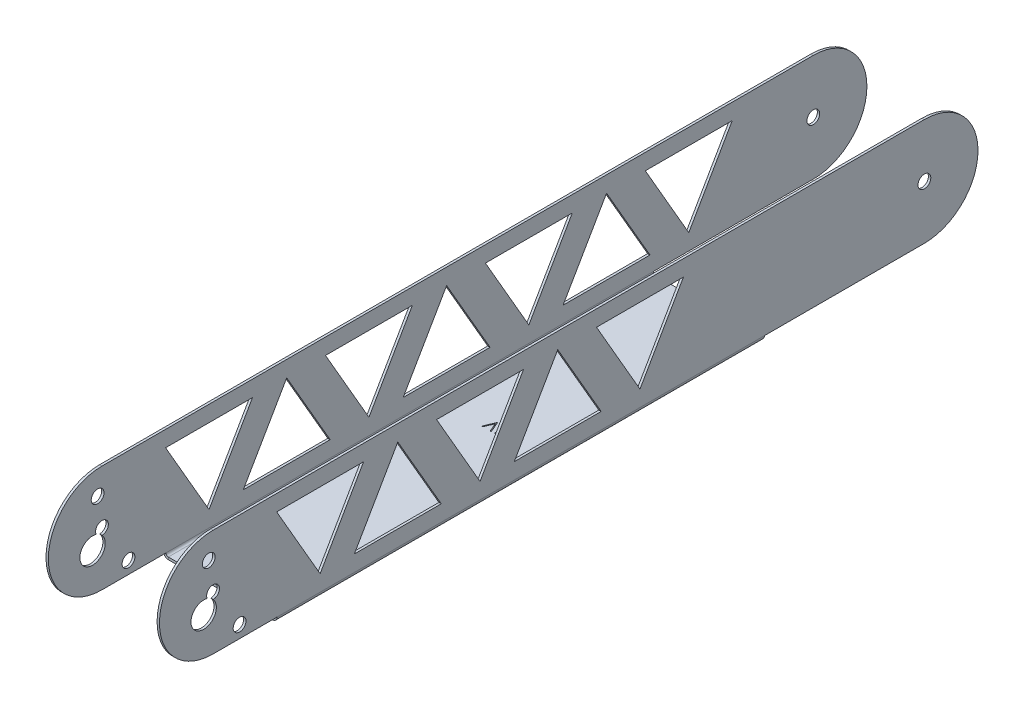
from build123d import *

# Parameters (mm, degrees)
SKETCH1_W                         = 32
SKETCH1_H                         = 152.4
BASE_FLANGE1_DEPTH                = 0.7366
EDGE_FLANGE1_DEPTH                = 152.4
EDGE_FLANGE1_BEND_DEPTH           = 152.4
SKETCH13_R                        = 2
TAB1_DEPTH                        = 0.7366
SKETCH21_R                        = 2
TAB2_DEPTH                        = 0.7366
CUT_EXTRUDE5_DEPTH                = 378.459903207
CUT_EXTRUDE5_DEPTH_BACK           = 378.459903207
SKETCH27_R                        = 3.96875
CUT_EXTRUDE6_DEPTH                = 152.231154983
CUT_EXTRUDE9_DEPTH                = 5
CUT_EXTRUDE10_DEPTH               = 5
SKETCH42_W                        = 2
SKETCH42_H                        = 35.4732
F_4_0_4_DIAMETER_HOLE1_AT_2_COUNT = 2
F_4_0_4_DIAMETER_HOLE1_AT_2_PITCH = 24.194584718


# Sheet-metal steps are written as plain solids
with BuildPart() as part:
    # Sketch1 → Base-Flange1 (new body)
    with BuildSketch(Plane(origin=(0, 0, 0), x_dir=(1, 0, 0), z_dir=(0, 1, 0))):
        Rectangle(SKETCH1_W, SKETCH1_H)
    extrude(amount=-BASE_FLANGE1_DEPTH)

    # Edge-Flange1 section (across the edge) → Edge-Flange1 (add)
    with BuildSketch(Plane(origin=(17, 0, 76.2), x_dir=(-1, 0, 0), z_dir=(0, 0, -1))):
        with BuildLine():
            Line((-0.7366, 0.7366), (-0.7366, 34.2634))
            Line((-0.7366, 34.2634), (0, 34.2634))
            Line((0, 34.2634), (0, 0.7366))
            ThreePointArc((0, 0.7366), (0.215745145, 0.215745145), (0.7366, 0))
            Line((0.7366, 0), (1, 0))
            Line((1, 0), (1, -0.7366))
            Line((1, -0.7366), (0.7366, -0.7366))
            ThreePointArc((0.7366, -0.7366), (-0.30510971, -0.30510971), (-0.7366, 0.7366))
        make_face()
    extrude(amount=EDGE_FLANGE1_DEPTH)

    # Edge-Flange1 section 2 (across the edge) → Edge-Flange1 bend (add)
    with BuildSketch(Plane(origin=(-17, 0, -76.2), x_dir=(1, 0, 0), z_dir=(0, 0, 1))):
        with BuildLine():
            Line((-0.7366, 0.7366), (-0.7366, 34.2634))
            Line((-0.7366, 34.2634), (0, 34.2634))
            Line((0, 34.2634), (0, 0.7366))
            ThreePointArc((0, 0.7366), (0.215745145, 0.215745145), (0.7366, 0))
            Line((0.7366, 0), (1, 0))
            Line((1, 0), (1, -0.7366))
            Line((1, -0.7366), (0.7366, -0.7366))
            ThreePointArc((0.7366, -0.7366), (-0.30510971, -0.30510971), (-0.7366, 0.7366))
        make_face()
    extrude(amount=EDGE_FLANGE1_BEND_DEPTH)

    # Sketch13 → Tab1 (add)
    with BuildSketch(Plane(origin=(17.7366, 0, 0), x_dir=(0, 0, -1), z_dir=(1, 0, 0))):
        with BuildLine():
            Line((76.2, 0.7366), (76.2, 34.2634))
            Line((76.2, 34.2634), (126.2, 34.2634))
            ThreePointArc((126.2, 34.2634), (142.9634, 17.5), (126.2, 0.7366))
            Line((126.2, 0.7366), (76.2, 0.7366))
        make_face()
        with Locations(Location((126.2, 17.5, 0), (0, 0, 90))):
            Circle(SKETCH13_R, mode=Mode.SUBTRACT)
    tab1 = extrude(amount=-TAB1_DEPTH)

    # Mirror1: Tab1 across plane
    add(tab1.mirror(Plane(origin=(0, 0, 0), x_dir=(0, 0, 1), z_dir=(1, 0, 0))))

    # Sketch21 → Tab2 (add)
    with BuildSketch(Plane.ZY.offset(17.7366)):
        with BuildLine():
            Line((76.2, 0.7366), (76.2, 34.2634))
            Line((76.2, 34.2634), (96.2, 34.2634))
            ThreePointArc((96.2, 34.2634), (112.9634, 17.5), (96.2, 0.7366))
            Line((96.2, 0.7366), (76.2, 0.7366))
        make_face()
        with Locations(Location((96.2, 17.5, 0), (0, 0, 270))):
            Circle(SKETCH21_R, mode=Mode.SUBTRACT)
    tab2 = extrude(amount=-TAB2_DEPTH)

    # Mirror2: Tab2 across plane
    add(tab2.mirror(Plane(origin=(0, 0, 0), x_dir=(0, 0, 1), z_dir=(1, 0, 0))))

    # Sketch27 → Cut-Extrude5 (cut, two sides: drawn at the far end of the back side and taken through both)
    with BuildSketch(Plane(origin=(-1.8, 181.68919546, 186.907982421), x_dir=(6.7392179279257654e-15, -0.7462813550386803, 0.6656306326496935), z_dir=(1, 0, 0)).offset(-CUT_EXTRUDE5_DEPTH_BACK)):
        with Locations((67.576820433, 177.878571709)):
            Circle(SKETCH27_R)
    extrude(amount=CUT_EXTRUDE5_DEPTH + CUT_EXTRUDE5_DEPTH_BACK, mode=Mode.SUBTRACT)

    # Sketch28 → Cut-Extrude6 (cut, through all)
    with BuildSketch(Plane.ZY.offset(17.7366)):
        Polygon((76.313906493, 29.2634), (49.147497867, 29.2634), (62.73070218, 5.7366), align=None)
        Polygon((52.02060197, 5.7366), (38.437397657, 29.2634), (24.854193344, 5.7366), align=None)
        Polygon((26.313906493, 29.2634), (-0.852502133, 29.2634), (12.73070218, 5.7366), align=None)
        Polygon((2.02060197, 5.7366), (-11.562602343, 29.2634), (-25.145806656, 5.7366), align=None)
        Polygon((-23.686093507, 29.2634), (-50.852502133, 29.2634), (-37.26929782, 5.7366), align=None)
    extrude(amount=-CUT_EXTRUDE6_DEPTH, mode=Mode.SUBTRACT)

    # Sketch34 → Cut-Extrude9 (cut)
    with BuildSketch(Plane.ZY.offset(17.7366)):
        Polygon((-47.97939803, 5.7366), (-75.145806656, 5.7366), (-61.562602343, 29.2634), align=None)
        Polygon((-73.686093507, 29.2634), (-100.852502133, 29.2634), (-87.26929782, 5.7366), align=None)
    extrude(amount=-CUT_EXTRUDE9_DEPTH, mode=Mode.SUBTRACT)

    # Sketch36 → Cut-Extrude10 (cut)
    # profile 1 of 4: a face of its own
    with BuildSketch(Plane.XZ.offset(0.7366)):
        Polygon((-2.7193999, -8.2157924), (-2.382861438, -8.2157924), (-1.216194772, -10.974005541), (-0.049528105, -8.2157924), (0.287010356, -8.2157924), (-1.193758874, -11.7157924), (-1.238630669, -11.7157924), align=None)
    # profile 2 of 4: a face of its own
    with BuildSketch(Plane.XZ.offset(0.7366)):
        Polygon((1.345003145, -8.2157924), (1.992138562, -8.2157924), (1.992138562, -11.7157924), (1.678035997, -11.7157924), (1.678035997, -8.574766759), (1.139574459, -8.574766759), align=None)
    # profile 3 of 4: a face of its own
    with BuildSketch(Plane.XZ.offset(0.7366)):
        with BuildLine():
            add(Edge.make_bspline(
                [(3.854318049, -11.177330861), (3.873808261, -11.178489028), (3.912016543, -11.180759478), (3.967255672, -11.196336152), (4.017250331, -11.223994813), (4.061782576, -11.260857591), (4.098489053, -11.305553254), (4.127133405, -11.355149163), (4.14257439, -11.410850755), (4.144828302, -11.44928043), (4.145984715, -11.468997528)],
                knots=[0, 0, 0, 0, 1.020151414, 1.999887582, 2.974338812, 3.990962822, 5.007586832, 5.987933904, 6.967670073, 8, 8, 8, 8], degree=3))
            add(Edge.make_bspline(
                [(4.145984715, -11.468997528), (4.144789115, -11.488240858), (4.142431408, -11.526188421), (4.127168799, -11.581469884), (4.098270749, -11.631096789), (4.062035756, -11.676398927), (4.017239323, -11.713339797), (3.967137476, -11.740763142), (3.912146218, -11.757455122), (3.873829895, -11.759581419), (3.854318049, -11.760664195)],
                knots=[0, 0, 0, 0, 1.009421747, 1.99056486, 2.972319754, 3.999869655, 5.017953583, 5.993804169, 6.978383603, 8, 8, 8, 8], degree=3))
            add(Edge.make_bspline(
                [(3.854318049, -11.760664195), (3.834792143, -11.759620597), (3.79667246, -11.757583222), (3.741886466, -11.740420416), (3.691479498, -11.713596956), (3.646691786, -11.676330046), (3.610153314, -11.631329903), (3.582527931, -11.581128107), (3.565937782, -11.526346669), (3.56375591, -11.488272026), (3.562651382, -11.468997528)],
                knots=[0, 0, 0, 0, 1.022052826, 1.995314843, 2.982371812, 4.00089066, 5.028879526, 6.005146991, 6.990147033, 8, 8, 8, 8], degree=3))
            add(Edge.make_bspline(
                [(3.562651382, -11.468997528), (3.563713481, -11.449248148), (3.5657871, -11.410689908), (3.58256276, -11.355490801), (3.609938972, -11.305322362), (3.646944367, -11.260925781), (3.691468663, -11.223738479), (3.741764868, -11.196673686), (3.796804408, -11.180633273), (3.834814347, -11.178450757), (3.854318049, -11.177330861)],
                knots=[0, 0, 0, 0, 1.032775665, 2.016367738, 2.991239715, 4.008302682, 5.025365648, 6.011011707, 6.979408107, 8, 8, 8, 8], degree=3))
        make_face()
    # profile 4 of 4: a face of its own
    with BuildSketch(Plane.XZ.offset(0.7366)):
        with BuildLine():
            add(Edge.make_bspline(
                [(4.594702664, -9.967194643), (4.595030682, -9.911097256), (4.595667862, -9.802127271), (4.602756283, -9.643342629), (4.614531625, -9.49438234), (4.630668998, -9.355239274), (4.650306979, -9.22587751), (4.676522465, -9.106642753), (4.706335268, -8.996983146), (4.740887714, -8.896541098), (4.779875503, -8.803963395), (4.822309763, -8.717538193), (4.869874558, -8.637396261), (4.919851471, -8.56225847), (4.974263542, -8.493354776), (5.031562333, -8.429712113), (5.093984209, -8.372801363), (5.159407217, -8.32095506), (5.228423682, -8.275505589), (5.299066348, -8.23547285), (5.371821454, -8.201272983), (5.446887637, -8.174382547), (5.523590194, -8.1521717), (5.602197261, -8.136982752), (5.682838625, -8.127425844), (5.73727006, -8.126512176), (5.76487494, -8.12604881)],
                knots=[0, 0, 0, 0, 1.646270934, 3.197905019, 4.663502075, 6.030701355, 7.308322542, 8.50163776, 9.611534131, 10.641858119, 11.616356847, 12.558055219, 13.465016945, 14.349605745, 15.204443733, 16.039544428, 16.859896111, 17.680448484, 18.487036065, 19.28249412, 20.06191084, 20.843045899, 21.620316918, 22.403196591, 23.190181807, 24, 24, 24, 24], degree=3))
            add(Edge.make_bspline(
                [(5.76487494, -8.12604881), (5.792710418, -8.126536625), (5.848066427, -8.127506736), (5.929906802, -8.136830679), (6.009856484, -8.152301802), (6.087574623, -8.174222776), (6.163699609, -8.201418453), (6.237636017, -8.23550557), (6.309843099, -8.275184437), (6.379173386, -8.321808315), (6.446388001, -8.373790591), (6.509835964, -8.43255326), (6.56952305, -8.497502979), (6.626198356, -8.567944843), (6.678253953, -8.645229928), (6.727827385, -8.728014038), (6.772199421, -8.817744902), (6.814934096, -8.91292537), (6.851821083, -9.016189029), (6.885087328, -9.12695379), (6.911966297, -9.246527976), (6.934355569, -9.374284222), (6.951700465, -9.510691705), (6.964333107, -9.65545802), (6.971006192, -9.808678411), (6.972262893, -9.91343626), (6.972907792, -9.967194643)],
                knots=[0, 0, 0, 0, 0.810914788, 1.612654377, 2.396697861, 3.181598691, 3.963628158, 4.749916497, 5.551656086, 6.361998678, 7.18212741, 8.025565596, 8.878627764, 9.750805457, 10.657531673, 11.591944965, 12.560506719, 13.57287815, 14.630710178, 15.753379473, 16.941251878, 18.199788006, 19.531962791, 20.947069417, 22.433333509, 24, 24, 24, 24], degree=3))
            add(Edge.make_bspline(
                [(6.972907792, -9.967194643), (6.972256208, -10.020718551), (6.970986622, -10.125007703), (6.964407915, -10.277538678), (6.951449284, -10.421536722), (6.935239296, -10.557347184), (6.912788333, -10.684404803), (6.885183166, -10.803149252), (6.854532844, -10.914093323), (6.816698049, -11.016328135), (6.775287339, -11.111279858), (6.730232143, -11.199947006), (6.681962317, -11.283113299), (6.629373572, -11.360113046), (6.573320159, -11.431491703), (6.51260237, -11.495989325), (6.448931785, -11.555159997), (6.381519369, -11.607811625), (6.311107818, -11.653896429), (6.239148741, -11.69511028), (6.164365357, -11.728342975), (6.088452405, -11.756878016), (6.010324039, -11.778678468), (5.930077648, -11.793752323), (5.848121412, -11.804324172), (5.792719847, -11.805130652), (5.76487494, -11.80553599)],
                knots=[0, 0, 0, 0, 1.561518951, 3.042555995, 4.452378317, 5.7783523, 7.031515105, 8.214008947, 9.334062868, 10.386615937, 11.391082383, 12.354592575, 13.286541444, 14.194233754, 15.072674879, 15.931287219, 16.775624067, 17.606195743, 18.42308326, 19.229000347, 20.022332153, 20.807536673, 21.593273796, 22.3848459, 23.188221202, 24, 24, 24, 24], degree=3))
            add(Edge.make_bspline(
                [(5.76487494, -11.80553599), (5.737270826, -11.805069634), (5.682840901, -11.804150072), (5.602188476, -11.794636341), (5.523906032, -11.779340837), (5.447607278, -11.757924233), (5.372900763, -11.731709397), (5.300804476, -11.697555713), (5.230516793, -11.658221644), (5.162225237, -11.613426223), (5.097213076, -11.56210454), (5.03511447, -11.505340251), (4.977489451, -11.44171684), (4.923855356, -11.372238917), (4.872881267, -11.297545674), (4.825991894, -11.216617301), (4.78262104, -11.129774691), (4.742977549, -11.03645678), (4.707828886, -10.935301852), (4.676781178, -10.825152674), (4.65226702, -10.705037038), (4.631284065, -10.575919671), (4.614359682, -10.43724574), (4.602805356, -10.288939962), (4.595664041, -10.131094753), (4.595028971, -10.022824979), (4.594702664, -9.967194643)],
                knots=[0, 0, 0, 0, 0.810891512, 1.598919785, 2.382837074, 3.152667961, 3.926044502, 4.706494248, 5.493654104, 6.291793342, 7.103789334, 7.925228297, 8.761435821, 9.622817696, 10.50288917, 11.416980706, 12.369136599, 13.353924996, 14.394355917, 15.514179734, 16.714354668, 17.994756427, 19.357759367, 20.818452758, 22.365282078, 24, 24, 24, 24], degree=3))
        make_face()
        with BuildLine():
            add(Edge.make_bspline(
                [(4.908805228, -9.9657924), (4.908924675, -10.012541099), (4.909156499, -10.103271143), (4.915212699, -10.235114404), (4.923462931, -10.358084733), (4.934104228, -10.47233827), (4.949907177, -10.577488282), (4.967613965, -10.674257965), (4.989162054, -10.762135202), (5.014657072, -10.841723013), (5.043696169, -10.914372082), (5.075402033, -10.981973297), (5.109462756, -11.045325233), (5.147581906, -11.103858841), (5.189096969, -11.157765006), (5.233070229, -11.207997838), (5.281142813, -11.252794819), (5.347646555, -11.306521674), (5.43544303, -11.362040808), (5.546063485, -11.410386898), (5.659731936, -11.440769354), (5.736883186, -11.44463311), (5.775391767, -11.446561631)],
                knots=[0, 0, 0, 0, 1.459021318, 2.831673884, 4.118529203, 5.306027144, 6.411944654, 7.436330062, 8.375795394, 9.233974572, 10.042671642, 10.816086306, 11.563610507, 12.285937304, 12.993564865, 13.685989202, 14.367179055, 15.041617293, 16.353048772, 17.594441528, 18.799311195, 20, 20, 20, 20], degree=3))
            add(Edge.make_bspline(
                [(5.775391767, -11.446561631), (5.814149438, -11.44496385), (5.891584761, -11.441771587), (6.004718557, -11.41097285), (6.114548827, -11.36450331), (6.200620767, -11.309555805), (6.26610331, -11.257227475), (6.313020301, -11.212612827), (6.356082349, -11.16265696), (6.396924424, -11.108757664), (6.4343835, -11.04988518), (6.468446637, -10.986322604), (6.499529985, -10.917893426), (6.517239031, -10.870123687), (6.526293209, -10.845700252)],
                knots=[0, 0, 0, 0, 1.353760809, 2.704726607, 4.075137775, 5.516104923, 6.260822281, 7.007110065, 7.778089737, 8.566572457, 9.372053459, 10.217411131, 11.088608312, 12, 12, 12, 12], degree=3))
            add(Edge.make_bspline(
                [(6.526293209, -10.845700252), (6.536844977, -10.814470513), (6.558269591, -10.751060749), (6.585881365, -10.652697097), (6.607626764, -10.549494333), (6.62719013, -10.442069216), (6.640543186, -10.329629515), (6.651290999, -10.212523131), (6.657621686, -10.090661769), (6.658406437, -10.007866778), (6.658805228, -9.9657924)],
                knots=[0, 0, 0, 0, 0.884706709, 1.796334032, 2.740027952, 3.714592787, 4.726048262, 5.777819803, 6.87074269, 8, 8, 8, 8], degree=3))
            add(Edge.make_bspline(
                [(6.658805228, -9.9657924), (6.658255039, -9.923724827), (6.657178751, -9.841431662), (6.653064763, -9.720913482), (6.642441189, -9.606445721), (6.63064207, -9.497535248), (6.613244849, -9.394784946), (6.594487042, -9.29733464), (6.56928583, -9.206391615), (6.542366055, -9.120532034), (6.511555659, -9.040731379), (6.477639925, -8.966617593), (6.441418166, -8.897832868), (6.402075926, -8.834565927), (6.360080243, -8.776533384), (6.314322694, -8.724898789), (6.266618321, -8.678061821), (6.199801135, -8.624599252), (6.112326845, -8.570087556), (6.003481198, -8.519921797), (5.890210554, -8.491113504), (5.813637099, -8.487051817), (5.775391767, -8.485023169)],
                knots=[0, 0, 0, 0, 1.31362396, 2.569729283, 3.763502607, 4.902122613, 5.988968491, 7.01645872, 7.998833611, 8.933434873, 9.825090667, 10.667526885, 11.477055099, 12.250526234, 12.991942729, 13.710640831, 14.402115721, 15.076753259, 16.378508321, 17.609869233, 18.806226677, 20, 20, 20, 20], degree=3))
            add(Edge.make_bspline(
                [(5.775391767, -8.485023169), (5.736681175, -8.487054616), (5.659189469, -8.49112121), (5.544741514, -8.519814463), (5.435037163, -8.569827429), (5.347794188, -8.624779802), (5.280930401, -8.677118113), (5.233847708, -8.722504567), (5.189701536, -8.772150822), (5.149033836, -8.826552736), (5.110944552, -8.885018104), (5.07596354, -8.948006869), (5.04444621, -9.015838233), (5.015361674, -9.088454668), (4.989788886, -9.168035613), (4.968694923, -9.255804606), (4.94920787, -9.352266498), (4.935412601, -9.457986006), (4.923148845, -9.572268159), (4.915267497, -9.695545478), (4.90913624, -9.827609858), (4.908917775, -9.918809016), (4.908805228, -9.9657924)],
                knots=[0, 0, 0, 0, 1.207732386, 2.417664972, 3.655092373, 4.956220595, 5.625982001, 6.301752483, 6.994047911, 7.697131622, 8.419323945, 9.170223765, 9.943494443, 10.752040957, 11.610060368, 12.549350801, 13.567764191, 14.679664412, 15.874934091, 17.154273443, 18.533957287, 20, 20, 20, 20], degree=3))
        make_face(mode=Mode.SUBTRACT)
    extrude(amount=-CUT_EXTRUDE10_DEPTH, mode=Mode.SUBTRACT)


with BuildPart() as cut_extrude10_piece_1:
    # of the separate pieces the step leaves, piece 1, a body of its own (cut_extrude10_pieces)
    add(part.part.solids().sort_by_distance((16.2634, -0.7366, -76.2))[0])

    # Sketch42 → Ø4.0 (4) Diameter Hole1 (revolve, cut)
    with BuildSketch(Plane(origin=(-17.7366, 4.550436979, 87.910687259), x_dir=(0, 0, 1), z_dir=(0, 1, 0))):
        with Locations((1, 17.7366)):
            Rectangle(SKETCH42_W, SKETCH42_H)
    f_4_0_4_diameter_hole1 = revolve(axis=Axis((-24.0866, 4.550436979, 87.910687259), (1, 0, 0)), mode=Mode.SUBTRACT)

    # Ø4.0 (4) Diameter Hole1 at 2: Ø4.0 (4) Diameter Hole1 ×2
    with Locations(*[Vector(-3.1203331884280615e-15, 0.9169563730061802, 0.39898748101080944) * (i * F_4_0_4_DIAMETER_HOLE1_AT_2_PITCH) for i in range(1, F_4_0_4_DIAMETER_HOLE1_AT_2_COUNT)]):
        add(f_4_0_4_diameter_hole1, mode=Mode.SUBTRACT)


with BuildPart() as cut_extrude10_piece_2:
    # of the separate pieces the step leaves, piece 2, a body of its own (cut_extrude10_pieces)
    add(part.part.solids().sort_by_distance((5.775391767, -0.7366, -8.485023169))[0])


solid = Compound([cut_extrude10_piece_1.part, cut_extrude10_piece_2.part])
